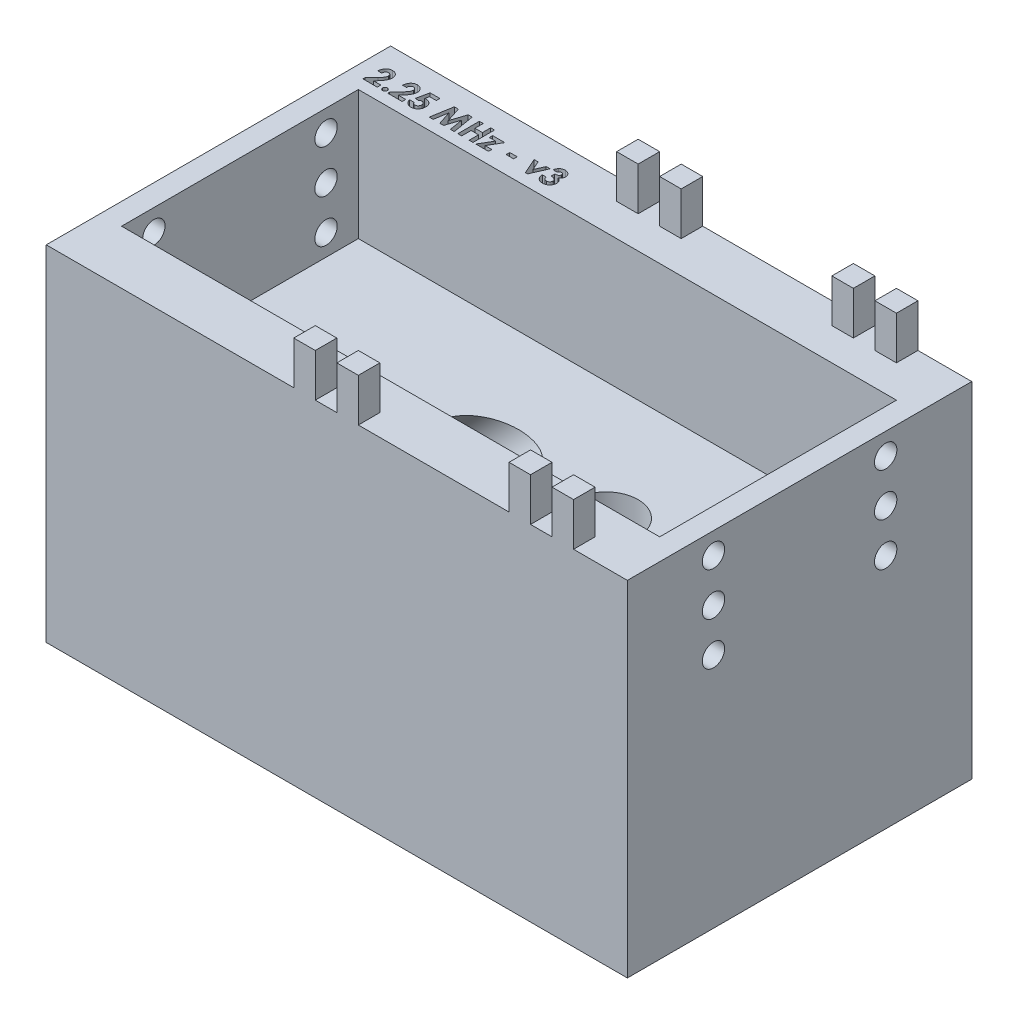
from build123d import *

# Parameters (mm, degrees)
SKETCH1_W                = 228.6
SKETCH1_H                = 127
BOSS_EXTRUDE1_DEPTH      = 50.8
SKETCH10_R               = 9.525
CUT_EXTRUDE6_DEPTH       = 196.514014843
SKETCH13_W               = 6.35
SKETCH13_H               = 6.35
BOSS_EXTRUDE3_DEPTH      = 12.7
SKETCH22_W               = 25.4
SKETCH22_H               = 101.6
CUT_EXTRUDE17_DEPTH      = 196.514014908
SKETCH23_W               = 254
SKETCH23_H               = 254
CUT_EXTRUDE18_DEPTH      = 25.4
SKETCH21_W               = 31.75
SKETCH21_H               = 101.6
CUT_EXTRUDE16_DEPTH      = 162.144934827
SKETCH26_W               = 158.75
SKETCH26_H               = 69.85
CUT_EXTRUDE21_DEPTH      = 38.1
CUT_EXTRUDE22_DEPTH      = 206.665511207
CUT_EXTRUDE22_DEPTH_BACK = 206.665511207
SKETCH27_R               = 3.302
SKETCH28_W               = 2.198076923
SKETCH28_H               = 1.058333333
CUT_EXTRUDE23_DEPTH      = 3.175


with BuildPart() as part:
    # Sketch1 → Boss-Extrude1 (new, symmetric)
    with BuildSketch(Plane.XY):
        with Locations((-25.4, -63.5)):
            Rectangle(SKETCH1_W, SKETCH1_H)
    extrude(amount=BOSS_EXTRUDE1_DEPTH, both=True)

    # Sketch10 → Cut-Extrude6 (cut, through all)
    with BuildSketch(Plane.XZ.offset(127)):
        Circle(SKETCH10_R)
    extrude(amount=-CUT_EXTRUDE6_DEPTH, mode=Mode.SUBTRACT)

    # Sketch2 → Cut-Revolve1 (revolve, cut)
    with BuildSketch(Plane.XY):
        Polygon((-66.480836064, -58.244528719), (-68.007479605, -56.717885178), (-13.829594426, -2.54), (0, 11.289594426), (55.278133078, 66.567727504), (59.72801651, 57.18801651), (0, -2.54), (-105.207008528, -107.747008528), (-129.286668415, -131.826668415), (-180.402882779, -182.942882779), (-185.791036451, -177.554729106), align=None)
    revolve(axis=Axis((-124.923032936, -127.463032936, 0), (0.7071067811865462, 0.7071067811865488, 0)), mode=Mode.SUBTRACT)

    # Sketch13 → Boss-Extrude3 (add)
    with BuildSketch(Plane(origin=(0, 0, 0), x_dir=(1, 0, 0), z_dir=(0, 1, 0))):
        with Locations((-38.1, 47.625)):
            Rectangle(SKETCH13_W, SKETCH13_H)
        with Locations((-25.4, 47.625)):
            Rectangle(SKETCH13_W, SKETCH13_H)
        with Locations((25.4, 47.625)):
            Rectangle(SKETCH13_W, SKETCH13_H)
        with Locations((38.1, 47.625)):
            Rectangle(SKETCH13_W, SKETCH13_H)
        with Locations((38.1, -47.625)):
            Rectangle(SKETCH13_W, SKETCH13_H)
        with Locations((25.4, -47.625)):
            Rectangle(SKETCH13_W, SKETCH13_H)
        with Locations((-25.4, -47.625)):
            Rectangle(SKETCH13_W, SKETCH13_H)
        with Locations((-38.1, -47.625)):
            Rectangle(SKETCH13_W, SKETCH13_H)
    extrude(amount=BOSS_EXTRUDE3_DEPTH)

    # Sketch22 → Cut-Extrude17 (cut, through all)
    with BuildSketch(Plane(origin=(0, 0, 0), x_dir=(1, 0, 0), z_dir=(0, 1, 0))):
        with Locations((-127, 0)):
            Rectangle(SKETCH22_W, SKETCH22_H)
    extrude(amount=-CUT_EXTRUDE17_DEPTH, mode=Mode.SUBTRACT)

    # Sketch23 → Cut-Extrude18 (cut)
    with BuildSketch(Plane.XZ.offset(127)):
        Rectangle(SKETCH23_W, SKETCH23_H)
    extrude(amount=-CUT_EXTRUDE18_DEPTH, mode=Mode.SUBTRACT)

    # Sketch21 → Cut-Extrude16 (cut, through all)
    with BuildSketch(Plane(origin=(0, 0, 0), x_dir=(1, 0, 0), z_dir=(0, 1, 0))):
        with Locations((73.025, 0)):
            Rectangle(SKETCH21_W, SKETCH21_H)
    extrude(amount=-CUT_EXTRUDE16_DEPTH, mode=Mode.SUBTRACT)

    # Sketch26 → Cut-Extrude21 (cut)
    with BuildSketch(Plane(origin=(0, 0, 0), x_dir=(1, 0, 0), z_dir=(0, 1, 0))):
        with Locations((-28.575, 0)):
            Rectangle(SKETCH26_W, SKETCH26_H)
    extrude(amount=-CUT_EXTRUDE21_DEPTH, mode=Mode.SUBTRACT)

    # Sketch27 → Cut-Extrude22 (cut, two sides: drawn at the far end of the back side and taken through both)
    with BuildSketch(Plane.ZY.offset(114.3).offset(-CUT_EXTRUDE22_DEPTH_BACK)):
        with Locations((-25.4, -6.35)):
            Circle(SKETCH27_R)
        with Locations((25.4, -6.35)):
            Circle(SKETCH27_R)
        with Locations((25.4, -19.05)):
            Circle(SKETCH27_R)
        with Locations((25.4, -31.75)):
            Circle(SKETCH27_R)
        with Locations((-25.4, -19.05)):
            Circle(SKETCH27_R)
        with Locations((-25.4, -31.75)):
            Circle(SKETCH27_R)
    extrude(amount=CUT_EXTRUDE22_DEPTH + CUT_EXTRUDE22_DEPTH_BACK, mode=Mode.SUBTRACT)

    # Sketch28 → Cut-Extrude23 (cut)
    with BuildSketch(Plane(origin=(0, 0, 0), x_dir=(1, 0, 0), z_dir=(0, 1, 0))):
        with BuildLine():
            Line((-108.679968791, 42.550408569), (-109.819712381, 42.550408569))
            add(Edge.make_bspline(
                [(-109.819712381, 42.550408569), (-109.814790003, 42.636624142), (-109.805171973, 42.805084195), (-109.766913878, 43.049777816), (-109.715649344, 43.28098638), (-109.647230018, 43.497901095), (-109.561256657, 43.70044314), (-109.459941579, 43.889302993), (-109.340696413, 44.063486302), (-109.206059088, 44.222153058), (-109.058315376, 44.364494468), (-108.900532582, 44.490703305), (-108.730297204, 44.59484766), (-108.550719582, 44.680548823), (-108.361830296, 44.74902007), (-108.161842154, 44.794798639), (-107.952486764, 44.825800335), (-107.809166047, 44.828513108), (-107.736118631, 44.829895748)],
                knots=[0, 0, 0, 0, 1.199038563, 2.342849363, 3.436047546, 4.486744587, 5.497670872, 6.488682221, 7.459191391, 8.424610317, 9.374430501, 10.305433194, 11.225809216, 12.140057399, 13.06607119, 14.010487599, 14.985989317, 16, 16, 16, 16], degree=3))
            add(Edge.make_bspline(
                [(-107.736118631, 44.829895748), (-107.646453965, 44.827097975), (-107.471407524, 44.821636064), (-107.217051161, 44.775044156), (-106.979510128, 44.697111989), (-106.758957095, 44.588220199), (-106.55726967, 44.449884594), (-106.374481297, 44.284942026), (-106.216119789, 44.089931913), (-106.081181086, 43.872968307), (-105.969063152, 43.643234383), (-105.890495573, 43.405679979), (-105.83885395, 43.166608826), (-105.833346051, 43.005630412), (-105.830609817, 42.92565897)],
                knots=[0, 0, 0, 0, 1.075374347, 2.099382735, 3.09057751, 4.06680945, 5.040638231, 6.016817125, 7.011024321, 8.044445721, 9.0776792, 10.070479129, 11.0414456, 12, 12, 12, 12], degree=3))
            add(Edge.make_bspline(
                [(-105.830609817, 42.92565897), (-105.831675162, 42.877286589), (-105.833819438, 42.779924936), (-105.848728877, 42.632592859), (-105.871095981, 42.482517913), (-105.904820123, 42.329828774), (-105.946876892, 42.17448264), (-105.997897832, 42.016014614), (-106.059066425, 41.855323151), (-106.129361889, 41.690599697), (-106.213224555, 41.521309458), (-106.310870974, 41.344914709), (-106.424892902, 41.161571926), (-106.553913097, 40.970245895), (-106.698558181, 40.771238367), (-106.859534262, 40.565148815), (-107.034987274, 40.351251044), (-107.159511212, 40.208272389), (-107.223488423, 40.134813617)],
                knots=[0, 0, 0, 0, 0.728284026, 1.46585585, 2.227944881, 3.01186502, 3.81876927, 4.650621989, 5.517437689, 6.406905708, 7.346299482, 8.360816762, 9.441613733, 10.596154504, 11.834900912, 13.145207542, 14.533280747, 16, 16, 16, 16], degree=3))
            Line((-107.223488423, 40.134813617), (-107.886218791, 39.375408569))
            Line((-107.886218791, 39.375408569), (-105.749199561, 39.375408569))
            Line((-105.749199561, 39.375408569), (-105.749199561, 38.317075236))
            Line((-105.749199561, 38.317075236), (-109.982532894, 38.317075236))
            Line((-109.982532894, 38.317075236), (-109.982532894, 38.894579242))
            Line((-109.982532894, 38.894579242), (-108.102464785, 40.8954907))
            add(Edge.make_bspline(
                [(-108.102464785, 40.8954907), (-108.048031982, 40.953857909), (-107.942611785, 41.066897883), (-107.792609708, 41.232909111), (-107.656871079, 41.390449803), (-107.538210549, 41.541197451), (-107.430400965, 41.680262414), (-107.338249549, 41.811836283), (-107.260913187, 41.934729584), (-107.176953598, 42.082917442), (-107.097219587, 42.259657832), (-107.024058806, 42.463270009), (-106.979462248, 42.657876356), (-106.973306513, 42.784686036), (-106.970353407, 42.845520748)],
                knots=[0, 0, 0, 0, 1.246127091, 2.413378631, 3.493388633, 4.492180848, 5.408488754, 6.240484944, 6.999099869, 7.674939598, 8.898438119, 10.020720584, 11.050475521, 12, 12, 12, 12], degree=3))
            add(Edge.make_bspline(
                [(-106.970353407, 42.845520748), (-106.972561373, 42.90437364), (-106.97683966, 43.018410552), (-107.023854577, 43.180627453), (-107.096691715, 43.327498297), (-107.19932953, 43.454634419), (-107.32365607, 43.5591106), (-107.467327066, 43.636817048), (-107.629171176, 43.681653313), (-107.74262698, 43.687265211), (-107.800992429, 43.690152159)],
                knots=[0, 0, 0, 0, 1.062038974, 2.057870785, 3.028805853, 4.01125022, 4.991535629, 5.949134679, 6.94496649, 8, 8, 8, 8], degree=3))
            add(Edge.make_bspline(
                [(-107.800992429, 43.690152159), (-107.831144764, 43.689085686), (-107.890504476, 43.686986162), (-107.977758614, 43.673010202), (-108.060787195, 43.648379032), (-108.140514374, 43.61537673), (-108.21608928, 43.571631942), (-108.28732129, 43.517709521), (-108.354960924, 43.454979759), (-108.418697958, 43.383638803), (-108.47670698, 43.304022276), (-108.528230382, 43.216857311), (-108.570831657, 43.122198014), (-108.608339368, 43.021294032), (-108.63726711, 42.913061575), (-108.658330094, 42.798148402), (-108.674342875, 42.676741461), (-108.678059371, 42.593285606), (-108.679968791, 42.550408569)],
                knots=[0, 0, 0, 0, 0.903469896, 1.778625579, 2.63899355, 3.493148037, 4.358286772, 5.247621495, 6.164656832, 7.118446693, 8.109501108, 9.111810964, 10.146451449, 11.215617525, 12.33435995, 13.498009769, 14.714554818, 16, 16, 16, 16], degree=3))
        make_face()
        with BuildLine():
            add(Edge.make_bspline(
                [(-104.080289304, 39.619639338), (-104.034279207, 39.617116715), (-103.943693271, 39.612150106), (-103.812808946, 39.575084821), (-103.694685089, 39.508491756), (-103.589066577, 39.421632645), (-103.499758223, 39.317129537), (-103.435208165, 39.19795652), (-103.395011225, 39.06757651), (-103.390573454, 38.97670558), (-103.388302125, 38.930196229)],
                knots=[0, 0, 0, 0, 1.016957001, 2.002212695, 2.9757545, 3.99499976, 5.013036768, 5.994806404, 6.97370641, 8, 8, 8, 8], degree=3))
            add(Edge.make_bspline(
                [(-103.388302125, 38.930196229), (-103.390558575, 38.883679409), (-103.394967274, 38.792793885), (-103.435486324, 38.66215982), (-103.499661765, 38.542007309), (-103.589073743, 38.436384382), (-103.694247686, 38.347888329), (-103.813080534, 38.28190935), (-103.943443939, 38.242741446), (-104.034235322, 38.238046495), (-104.080289304, 38.235664979)],
                knots=[0, 0, 0, 0, 1.023218912, 1.999186227, 2.986238111, 4.008388923, 5.030539734, 6.0011649, 6.986089706, 8, 8, 8, 8], degree=3))
            add(Edge.make_bspline(
                [(-104.080289304, 38.235664979), (-104.126354199, 38.23802713), (-104.217167094, 38.242683902), (-104.347733141, 38.282239497), (-104.467443305, 38.347447828), (-104.572643674, 38.436491727), (-104.662455104, 38.541633289), (-104.724805978, 38.662538922), (-104.765702452, 38.792744634), (-104.770050881, 38.883662735), (-104.772276484, 38.930196229)],
                knots=[0, 0, 0, 0, 1.013427518, 1.99788335, 2.976245624, 3.997909735, 5.019573847, 6.001765691, 6.977268297, 8, 8, 8, 8], degree=3))
            add(Edge.make_bspline(
                [(-104.772276484, 38.930196229), (-104.770036198, 38.976722544), (-104.765659081, 39.067626618), (-104.725083345, 39.197573051), (-104.662355176, 39.317505589), (-104.572651164, 39.421525076), (-104.467003649, 39.508928819), (-104.348006252, 39.574759198), (-104.216917888, 39.612208075), (-104.126310366, 39.617136241), (-104.080289304, 39.619639338)],
                knots=[0, 0, 0, 0, 1.025808215, 2.00424526, 2.981110158, 3.998665696, 5.017428914, 5.998734231, 6.983523959, 8, 8, 8, 8], degree=3))
        make_face()
        with BuildLine():
            Line((-101.353045714, 42.550408569), (-102.492789304, 42.550408569))
            add(Edge.make_bspline(
                [(-102.492789304, 42.550408569), (-102.487866926, 42.636624142), (-102.478248896, 42.805084195), (-102.439990801, 43.049777816), (-102.388726267, 43.28098638), (-102.320306941, 43.497901095), (-102.23433358, 43.70044314), (-102.133018502, 43.889302993), (-102.013773336, 44.063486302), (-101.879136012, 44.222153058), (-101.7313923, 44.364494468), (-101.573609505, 44.490703305), (-101.403374127, 44.59484766), (-101.223796505, 44.680548823), (-101.034907219, 44.74902007), (-100.834919077, 44.794798639), (-100.625563687, 44.825800335), (-100.48224297, 44.828513108), (-100.409195554, 44.829895748)],
                knots=[0, 0, 0, 0, 1.199038563, 2.342849363, 3.436047546, 4.486744587, 5.497670872, 6.488682221, 7.459191391, 8.424610317, 9.374430501, 10.305433194, 11.225809216, 12.140057399, 13.06607119, 14.010487599, 14.985989317, 16, 16, 16, 16], degree=3))
            add(Edge.make_bspline(
                [(-100.409195554, 44.829895748), (-100.319530888, 44.827097975), (-100.144484447, 44.821636064), (-99.890128084, 44.775044156), (-99.652587051, 44.697111989), (-99.432034018, 44.588220199), (-99.230346593, 44.449884594), (-99.04755822, 44.284942026), (-98.889196712, 44.089931913), (-98.754258009, 43.872968307), (-98.642140075, 43.643234383), (-98.563572496, 43.405679979), (-98.511930873, 43.166608826), (-98.506422974, 43.005630412), (-98.50368674, 42.92565897)],
                knots=[0, 0, 0, 0, 1.075374347, 2.099382735, 3.09057751, 4.06680945, 5.040638231, 6.016817125, 7.011024321, 8.044445721, 9.0776792, 10.070479129, 11.0414456, 12, 12, 12, 12], degree=3))
            add(Edge.make_bspline(
                [(-98.50368674, 42.92565897), (-98.504752085, 42.877286589), (-98.506896361, 42.779924936), (-98.5218058, 42.632592859), (-98.544172904, 42.482517913), (-98.577897046, 42.329828774), (-98.619953815, 42.17448264), (-98.670974756, 42.016014614), (-98.732143348, 41.855323151), (-98.802438812, 41.690599697), (-98.886301479, 41.521309458), (-98.983947897, 41.344914709), (-99.097969825, 41.161571926), (-99.22699002, 40.970245895), (-99.371635104, 40.771238367), (-99.532611185, 40.565148815), (-99.708064197, 40.351251044), (-99.832588135, 40.208272389), (-99.896565346, 40.134813617)],
                knots=[0, 0, 0, 0, 0.728284026, 1.46585585, 2.227944881, 3.01186502, 3.81876927, 4.650621989, 5.517437689, 6.406905708, 7.346299482, 8.360816762, 9.441613733, 10.596154504, 11.834900912, 13.145207542, 14.533280747, 16, 16, 16, 16], degree=3))
            Line((-99.896565346, 40.134813617), (-100.559295714, 39.375408569))
            Line((-100.559295714, 39.375408569), (-98.422276484, 39.375408569))
            Line((-98.422276484, 39.375408569), (-98.422276484, 38.317075236))
            Line((-98.422276484, 38.317075236), (-102.655609817, 38.317075236))
            Line((-102.655609817, 38.317075236), (-102.655609817, 38.894579242))
            Line((-102.655609817, 38.894579242), (-100.775541708, 40.8954907))
            add(Edge.make_bspline(
                [(-100.775541708, 40.8954907), (-100.721108905, 40.953857909), (-100.615688708, 41.066897883), (-100.465686631, 41.232909111), (-100.329948002, 41.390449803), (-100.211287472, 41.541197451), (-100.103477888, 41.680262414), (-100.011326472, 41.811836283), (-99.93399011, 41.934729584), (-99.850030521, 42.082917442), (-99.77029651, 42.259657832), (-99.69713573, 42.463270009), (-99.652539171, 42.657876356), (-99.646383436, 42.784686036), (-99.64343033, 42.845520748)],
                knots=[0, 0, 0, 0, 1.246127091, 2.413378631, 3.493388633, 4.492180848, 5.408488754, 6.240484944, 6.999099869, 7.674939598, 8.898438119, 10.020720584, 11.050475521, 12, 12, 12, 12], degree=3))
            add(Edge.make_bspline(
                [(-99.64343033, 42.845520748), (-99.645638296, 42.90437364), (-99.649916583, 43.018410552), (-99.6969315, 43.180627453), (-99.769768638, 43.327498297), (-99.872406453, 43.454634419), (-99.996732993, 43.5591106), (-100.140403989, 43.636817048), (-100.302248099, 43.681653313), (-100.415703903, 43.687265211), (-100.474069352, 43.690152159)],
                knots=[0, 0, 0, 0, 1.062038974, 2.057870785, 3.028805853, 4.01125022, 4.991535629, 5.949134679, 6.94496649, 8, 8, 8, 8], degree=3))
            add(Edge.make_bspline(
                [(-100.474069352, 43.690152159), (-100.504221687, 43.689085686), (-100.563581399, 43.686986162), (-100.650835537, 43.673010202), (-100.733864118, 43.648379032), (-100.813591297, 43.61537673), (-100.889166203, 43.571631942), (-100.960398213, 43.517709521), (-101.028037847, 43.454979759), (-101.091774881, 43.383638803), (-101.149783903, 43.304022276), (-101.201307305, 43.216857311), (-101.24390858, 43.122198014), (-101.281416291, 43.021294032), (-101.310344033, 42.913061575), (-101.331407018, 42.798148402), (-101.347419798, 42.676741461), (-101.351136294, 42.593285606), (-101.353045714, 42.550408569)],
                knots=[0, 0, 0, 0, 0.903469896, 1.778625579, 2.63899355, 3.493148037, 4.358286772, 5.247621495, 6.164656832, 7.118446693, 8.109501108, 9.111810964, 10.146451449, 11.215617525, 12.33435995, 13.498009769, 14.714554818, 16, 16, 16, 16], degree=3))
        make_face()
        with BuildLine():
            Line((-96.510407493, 44.667075236), (-93.619071355, 44.667075236))
            Line((-93.619071355, 44.667075236), (-93.619071355, 43.608741902))
            Line((-93.619071355, 43.608741902), (-95.607262461, 43.608741902))
            Line((-95.607262461, 43.608741902), (-95.855309336, 42.40794062))
            add(Edge.make_bspline(
                [(-95.855309336, 42.40794062), (-95.821509399, 42.41735433), (-95.754848978, 42.435920098), (-95.65442497, 42.454539215), (-95.557100113, 42.466607535), (-95.493236135, 42.468217288), (-95.462250442, 42.468998313)],
                knots=[0, 0, 0, 0, 1.05461699, 2.079921384, 3.068411212, 4, 4, 4, 4], degree=3))
            add(Edge.make_bspline(
                [(-95.462250442, 42.468998313), (-95.394729372, 42.467451106), (-95.261630468, 42.464401222), (-95.066923663, 42.435447873), (-94.880480394, 42.389847225), (-94.702871199, 42.324811292), (-94.534269578, 42.240165346), (-94.374471154, 42.13776748), (-94.2232798, 42.017437844), (-94.083381311, 41.879101104), (-93.954836736, 41.727204232), (-93.843074559, 41.562911691), (-93.747622686, 41.388566135), (-93.671703566, 41.203083835), (-93.611781724, 41.007629744), (-93.568480863, 40.802078611), (-93.542874901, 40.586186825), (-93.539422094, 40.438899295), (-93.537661099, 40.363779963)],
                knots=[0, 0, 0, 0, 1.01440847, 1.999622559, 2.951875003, 3.895578053, 4.836219714, 5.782137149, 6.743708247, 7.735272588, 8.734977101, 9.730283169, 10.717124674, 11.717316708, 12.737475749, 13.78628267, 14.87096371, 16, 16, 16, 16], degree=3))
            add(Edge.make_bspline(
                [(-93.537661099, 40.363779963), (-93.539813063, 40.287807853), (-93.544059516, 40.137892672), (-93.571763735, 39.917464328), (-93.620662179, 39.706343737), (-93.687829084, 39.503965733), (-93.776317182, 39.311817747), (-93.88273623, 39.12790927), (-94.008885488, 38.953605395), (-94.153526998, 38.790692948), (-94.310771294, 38.641787844), (-94.47819935, 38.510795739), (-94.654634935, 38.400566944), (-94.840082304, 38.311483441), (-95.033477488, 38.24100216), (-95.234879184, 38.189695152), (-95.445266178, 38.160273434), (-95.588091612, 38.156283006), (-95.660687942, 38.154254723)],
                knots=[0, 0, 0, 0, 1.06808661, 2.107647099, 3.116961351, 4.110378221, 5.100014249, 6.085620622, 7.093190682, 8.119403071, 9.144090782, 10.133780668, 11.103064255, 12.062861538, 13.020824475, 13.992378307, 14.979551724, 16, 16, 16, 16], degree=3))
            add(Edge.make_bspline(
                [(-95.660687942, 38.154254723), (-95.725608679, 38.155913985), (-95.853645959, 38.159186396), (-96.042239252, 38.179300361), (-96.224064128, 38.21486204), (-96.398155298, 38.266328997), (-96.566344491, 38.329673072), (-96.726687391, 38.408896809), (-96.880065112, 38.50249168), (-97.026042117, 38.608749578), (-97.162246489, 38.728444979), (-97.286559406, 38.859472218), (-97.399733477, 39.000179761), (-97.499346952, 39.152303511), (-97.585087573, 39.315618714), (-97.661124106, 39.488200664), (-97.723360769, 39.671851665), (-97.754944083, 39.799168742), (-97.770994432, 39.863870107)],
                knots=[0, 0, 0, 0, 1.054957082, 2.080596141, 3.077793124, 4.061112343, 5.027190972, 5.994718051, 6.962465889, 7.943658696, 8.924948258, 9.904494768, 10.875059, 11.855380583, 12.854004648, 13.869083016, 14.917087635, 16, 16, 16, 16], degree=3))
            Line((-97.770994432, 39.863870107), (-96.46843033, 39.863870107))
            add(Edge.make_bspline(
                [(-96.46843033, 39.863870107), (-96.444619427, 39.819034696), (-96.398345653, 39.731902191), (-96.310322707, 39.616220699), (-96.211786606, 39.517572491), (-96.103626201, 39.434993755), (-95.985140679, 39.373127172), (-95.861158102, 39.326210417), (-95.730120928, 39.299098962), (-95.640878827, 39.295709761), (-95.595814144, 39.293998313)],
                knots=[0, 0, 0, 0, 1.104910296, 2.147267069, 3.153527244, 4.136738762, 5.099945312, 6.05603338, 7.018353, 8, 8, 8, 8], degree=3))
            add(Edge.make_bspline(
                [(-95.595814144, 39.293998313), (-95.564404664, 39.295180083), (-95.502605983, 39.297505235), (-95.411555399, 39.309805876), (-95.324643617, 39.33310301), (-95.241224467, 39.365364125), (-95.161073865, 39.405597379), (-95.085340799, 39.456389242), (-95.012707647, 39.514852558), (-94.944280183, 39.581939412), (-94.882304624, 39.656725649), (-94.827958838, 39.737088559), (-94.77936621, 39.821242461), (-94.743372908, 39.912520901), (-94.713897437, 40.008198274), (-94.692190508, 40.108996304), (-94.67921817, 40.215032713), (-94.678017279, 40.287420797), (-94.677404689, 40.32434687)],
                knots=[0, 0, 0, 0, 0.978869489, 1.925942215, 2.855067702, 3.774946051, 4.70828698, 5.642468714, 6.60995405, 7.609372294, 8.622401667, 9.629904756, 10.629323, 11.642352373, 12.678539694, 13.745912462, 14.850161547, 16, 16, 16, 16], degree=3))
            add(Edge.make_bspline(
                [(-94.677404689, 40.32434687), (-94.67811567, 40.360415806), (-94.679499613, 40.430624865), (-94.690947862, 40.533716912), (-94.71142856, 40.631532608), (-94.739333687, 40.724821147), (-94.77505558, 40.813016037), (-94.818710122, 40.896642256), (-94.870483809, 40.975277103), (-94.930654602, 41.047319652), (-94.994820117, 41.113399126), (-95.063754498, 41.171191707), (-95.136836684, 41.219155537), (-95.211795735, 41.261029356), (-95.291623746, 41.291504209), (-95.374525707, 41.312491116), (-95.460414435, 41.327890464), (-95.518997273, 41.328795232), (-95.548748839, 41.329254723)],
                knots=[0, 0, 0, 0, 1.166249705, 2.270133367, 3.348514167, 4.393962215, 5.415026464, 6.420877785, 7.440098956, 8.453121383, 9.451844239, 10.415694839, 11.355045125, 12.27538808, 13.187007209, 14.108269027, 15.039275622, 16, 16, 16, 16], degree=3))
            add(Edge.make_bspline(
                [(-95.548748839, 41.329254723), (-95.581065956, 41.328028468), (-95.645836389, 41.32557079), (-95.742069043, 41.305573319), (-95.837141398, 41.27320991), (-95.931582155, 41.228559459), (-96.024453826, 41.170126106), (-96.118207339, 41.101590484), (-96.209704564, 41.017972827), (-96.267881044, 40.955694206), (-96.297977605, 40.923475476)],
                knots=[0, 0, 0, 0, 0.88288272, 1.769486374, 2.674910571, 3.623812639, 4.617874466, 5.670434592, 6.794841017, 8, 8, 8, 8], degree=3))
            Line((-96.297977605, 40.923475476), (-97.257092189, 41.143537575))
            Line((-97.257092189, 41.143537575), (-96.510407493, 44.667075236))
        make_face()
        Polygon((-89.371745634, 44.667075236), (-88.188752846, 44.667075236), (-86.739904689, 40.237848473), (-85.28088025, 44.667075236), (-84.109335779, 44.667075236), (-83.035738022, 38.317075236), (-84.189474, 38.317075236), (-84.867468791, 42.327802399), (-86.187841388, 38.317075236), (-87.299600202, 38.317075236), (-88.612340586, 42.327802399), (-89.289063343, 38.317075236), (-90.444071355, 38.317075236), align=None)
        Polygon((-81.977404689, 44.667075236), (-80.837661099, 44.667075236), (-80.837661099, 42.224767543), (-78.639584176, 42.224767543), (-78.639584176, 44.667075236), (-77.499840586, 44.667075236), (-77.499840586, 38.317075236), (-78.639584176, 38.317075236), (-78.639584176, 41.085023954), (-80.837661099, 41.085023954), (-80.837661099, 38.317075236), (-81.977404689, 38.317075236), align=None)
        Polygon((-76.360096996, 42.957459851), (-72.778045714, 42.957459851), (-74.912520875, 39.293998313), (-72.940866227, 39.293998313), (-72.940866227, 38.317075236), (-76.685738022, 38.317075236), (-74.551262862, 41.980536774), (-76.360096996, 41.980536774), align=None)
        with Locations((-68.422596997, 40.637267544)):
            Rectangle(SKETCH28_W, SKETCH28_H)
        Polygon((-64.107853407, 42.957459851), (-62.947757253, 42.957459851), (-61.746955971, 40.218767944), (-60.546154689, 42.957459851), (-59.386058535, 42.957459851), (-61.418770875, 38.317075236), (-62.075141067, 38.317075236), align=None)
        with BuildLine():
            Line((-57.554327766, 43.120280364), (-58.694071355, 43.120280364))
            add(Edge.make_bspline(
                [(-58.694071355, 43.120280364), (-58.686024332, 43.17725208), (-58.670248676, 43.288941355), (-58.632499641, 43.450639603), (-58.587347722, 43.604021457), (-58.530977858, 43.748601189), (-58.464865178, 43.884636342), (-58.389681974, 44.012593723), (-58.304615487, 44.131924116), (-58.239411124, 44.203809218), (-58.206881852, 44.239671389)],
                knots=[0, 0, 0, 0, 1.111473889, 2.178970933, 3.205615836, 4.199322666, 5.174200091, 6.12565194, 7.064921805, 8, 8, 8, 8], degree=3))
            add(Edge.make_bspline(
                [(-58.206881852, 44.239671389), (-58.159962688, 44.286988926), (-58.067489945, 44.380246818), (-57.912957147, 44.499699876), (-57.750978236, 44.603078375), (-57.578304653, 44.685037596), (-57.397623331, 44.751374091), (-57.207497428, 44.795932464), (-57.008703869, 44.825497338), (-56.873052273, 44.828409581), (-56.803826964, 44.829895748)],
                knots=[0, 0, 0, 0, 1.01925491, 2.00884431, 2.983262333, 3.955970413, 4.92937149, 5.924503185, 6.940838805, 8, 8, 8, 8], degree=3))
            add(Edge.make_bspline(
                [(-56.803826964, 44.829895748), (-56.742282104, 44.828442795), (-56.621297309, 44.825586581), (-56.443480103, 44.802658446), (-56.273946278, 44.762445049), (-56.110903812, 44.709866936), (-55.956750528, 44.638325625), (-55.808084114, 44.555281391), (-55.669058315, 44.453424186), (-55.539347837, 44.338335796), (-55.420184024, 44.213856435), (-55.31698764, 44.080798235), (-55.228267857, 43.942715488), (-55.15517449, 43.798460987), (-55.098975624, 43.647790635), (-55.059971945, 43.491574836), (-55.034443089, 43.33015829), (-55.031899748, 43.220445639), (-55.030609817, 43.164801598)],
                knots=[0, 0, 0, 0, 1.091422571, 2.145516843, 3.172569842, 4.178562979, 5.178154469, 6.181868002, 7.194278174, 8.227918432, 9.254613415, 10.245994977, 11.209837596, 12.161663635, 13.10878368, 14.055455738, 15.013766427, 16, 16, 16, 16], degree=3))
            add(Edge.make_bspline(
                [(-55.030609817, 43.164801598), (-55.033256833, 43.095891087), (-55.038467993, 42.960227477), (-55.081229339, 42.761673704), (-55.148162472, 42.571820864), (-55.244853893, 42.393325283), (-55.365742796, 42.226672727), (-55.514069432, 42.07743489), (-55.685609072, 41.943271925), (-55.814386165, 41.871172731), (-55.880329368, 41.83425272)],
                knots=[0, 0, 0, 0, 0.992805628, 1.954529043, 2.915727527, 3.886831945, 4.871318353, 5.87440735, 6.911542536, 8, 8, 8, 8], degree=3))
            add(Edge.make_bspline(
                [(-55.880329368, 41.83425272), (-55.835066965, 41.81939212), (-55.746128373, 41.790191707), (-55.619712859, 41.732681826), (-55.49950615, 41.669833058), (-55.387578162, 41.596819356), (-55.282815637, 41.516593073), (-55.18585722, 41.428468403), (-55.096123606, 41.332637501), (-55.01507966, 41.228573332), (-54.943149991, 41.117940201), (-54.87861133, 41.003293666), (-54.825492414, 40.882895093), (-54.780494079, 40.758119515), (-54.746234909, 40.627845515), (-54.722113391, 40.492577893), (-54.708170562, 40.352625203), (-54.706044043, 40.257807341), (-54.704968791, 40.209863697)],
                knots=[0, 0, 0, 0, 1.059543567, 2.081955587, 3.086750234, 4.076226789, 5.052108497, 6.020845489, 6.989030705, 7.970690546, 8.952259656, 9.923888338, 10.895517021, 11.877585046, 12.873342345, 13.889638361, 14.932918083, 16, 16, 16, 16], degree=3))
            add(Edge.make_bspline(
                [(-54.704968791, 40.209863697), (-54.707148471, 40.139406007), (-54.711446356, 40.000477791), (-54.738770297, 39.795850747), (-54.789642551, 39.60075704), (-54.856567819, 39.412951823), (-54.945838864, 39.234859594), (-55.050895875, 39.062393379), (-55.180032051, 38.901534257), (-55.323544736, 38.748029532), (-55.48292394, 38.60846991), (-55.655716925, 38.487477997), (-55.838124122, 38.383645409), (-56.03129957, 38.299351155), (-56.235176155, 38.234434939), (-56.449299453, 38.187510506), (-56.674569154, 38.158801361), (-56.828333349, 38.155791752), (-56.90686182, 38.154254723)],
                knots=[0, 0, 0, 0, 1.005138573, 1.981928558, 2.936866704, 3.876260664, 4.820238198, 5.773547, 6.751179199, 7.756627054, 8.768222608, 9.766606018, 10.760583154, 11.757261445, 12.767156078, 13.807575856, 14.880313354, 16, 16, 16, 16], degree=3))
            add(Edge.make_bspline(
                [(-56.90686182, 38.154254723), (-56.981148487, 38.15587526), (-57.126406235, 38.159044006), (-57.338876092, 38.18647111), (-57.540808579, 38.230713254), (-57.732719031, 38.293076224), (-57.913864964, 38.373950339), (-58.085889077, 38.470253264), (-58.245358667, 38.587539527), (-58.394050541, 38.720514605), (-58.528666264, 38.869705093), (-58.648981018, 39.031655066), (-58.752341843, 39.206980355), (-58.839172624, 39.394931895), (-58.908794538, 39.595839412), (-58.9637121, 39.809294349), (-59.002072916, 40.035713731), (-59.013755783, 40.191495082), (-59.019712381, 40.270921389)],
                knots=[0, 0, 0, 0, 1.066544725, 2.085487077, 3.070979577, 4.031932826, 4.977951092, 5.916076795, 6.857635327, 7.814973522, 8.776389752, 9.738577119, 10.707772778, 11.69409279, 12.707140348, 13.757286496, 14.856535458, 16, 16, 16, 16], degree=3))
            Line((-59.019712381, 40.270921389), (-57.879968791, 40.270921389))
            add(Edge.make_bspline(
                [(-57.879968791, 40.270921389), (-57.872746355, 40.2309848), (-57.858678766, 40.153197817), (-57.831240797, 40.04057956), (-57.795485296, 39.936625952), (-57.75414304, 39.840413057), (-57.709487179, 39.750677635), (-57.655532221, 39.670733834), (-57.596231702, 39.598410854), (-57.510660619, 39.512432498), (-57.388330863, 39.424093327), (-57.223145164, 39.347322384), (-57.039391718, 39.30232518), (-56.910929733, 39.296835659), (-56.844532093, 39.293998313)],
                knots=[0, 0, 0, 0, 0.928156231, 1.807827665, 2.648129825, 3.438902246, 4.202261636, 4.936546065, 5.639352463, 6.338805438, 7.70633318, 9.064371875, 10.482673459, 12, 12, 12, 12], degree=3))
            add(Edge.make_bspline(
                [(-56.844532093, 39.293998313), (-56.809299158, 39.294602499), (-56.740285721, 39.295785965), (-56.638915259, 39.308903099), (-56.54234562, 39.330507028), (-56.450396939, 39.359865967), (-56.362483865, 39.396669233), (-56.280286066, 39.444124842), (-56.202128144, 39.499298762), (-56.128859747, 39.561328895), (-56.061158239, 39.628919536), (-56.004826603, 39.703764686), (-55.953343563, 39.779820737), (-55.915266336, 39.862063542), (-55.881902482, 39.94606756), (-55.861482099, 40.034881873), (-55.846063243, 40.126643397), (-55.845167161, 40.189440956), (-55.844712381, 40.221312014)],
                knots=[0, 0, 0, 0, 1.110435564, 2.175094844, 3.216326037, 4.226890168, 5.215276772, 6.21526065, 7.213097102, 8.228249917, 9.239874822, 10.221364777, 11.178138315, 12.128914389, 13.072518965, 14.022636769, 14.996447288, 16, 16, 16, 16], degree=3))
            add(Edge.make_bspline(
                [(-55.844712381, 40.221312014), (-55.845919737, 40.256168447), (-55.848323307, 40.325559619), (-55.867960721, 40.426821442), (-55.898972348, 40.524227155), (-55.942051287, 40.617345399), (-55.999578408, 40.705832959), (-56.067459769, 40.791465163), (-56.151043299, 40.869785008), (-56.242745625, 40.947201801), (-56.349084298, 41.014685895), (-56.464880476, 41.076963799), (-56.593177461, 41.126517784), (-56.730843409, 41.17077867), (-56.880482402, 41.203106135), (-57.041165235, 41.226579025), (-57.212632705, 41.244050953), (-57.33082746, 41.246557589), (-57.391507253, 41.247844466)],
                knots=[0, 0, 0, 0, 0.809814727, 1.612155564, 2.388397, 3.182215007, 3.988903953, 4.837162975, 5.715530372, 6.646997145, 7.623086902, 8.637258368, 9.698941581, 10.815059213, 11.996518529, 13.252603015, 14.589518788, 16, 16, 16, 16], degree=3))
            Line((-57.391507253, 41.247844466), (-57.391507253, 42.3061778))
            add(Edge.make_bspline(
                [(-57.391507253, 42.3061778), (-57.315957301, 42.312611875), (-57.174618304, 42.324648757), (-56.978432196, 42.352797422), (-56.813268783, 42.390422748), (-56.67515836, 42.435815667), (-56.560480313, 42.494112001), (-56.460298205, 42.558468579), (-56.374016634, 42.633209339), (-56.301097133, 42.716105522), (-56.242763801, 42.80512825), (-56.201478866, 42.898893844), (-56.174216453, 42.994501083), (-56.171633341, 43.059893552), (-56.170353407, 43.092295588)],
                knots=[0, 0, 0, 0, 1.70044513, 3.18119609, 4.440695891, 5.496282586, 6.431922213, 7.318171381, 8.16090191, 8.983045123, 9.787564368, 10.536848927, 11.275007137, 12, 12, 12, 12], degree=3))
            add(Edge.make_bspline(
                [(-56.170353407, 43.092295588), (-56.17256166, 43.133637068), (-56.176871703, 43.214326884), (-56.210345832, 43.329811009), (-56.268453127, 43.432755534), (-56.346364806, 43.522943836), (-56.441302896, 43.598275865), (-56.55258698, 43.652965634), (-56.677802188, 43.685098315), (-56.765897833, 43.688429391), (-56.811459176, 43.690152159)],
                knots=[0, 0, 0, 0, 1.009664648, 1.970651636, 2.907870547, 3.878035693, 4.867062054, 5.849714035, 6.887914197, 8, 8, 8, 8], degree=3))
            add(Edge.make_bspline(
                [(-56.811459176, 43.690152159), (-56.852755411, 43.688119474), (-56.934699789, 43.684086006), (-57.054526997, 43.653981265), (-57.168322922, 43.603303681), (-57.273731173, 43.53342228), (-57.369230159, 43.449497679), (-57.447607273, 43.350106409), (-57.512797641, 43.241203174), (-57.540430121, 43.160745984), (-57.554327766, 43.120280364)],
                knots=[0, 0, 0, 0, 0.98818071, 1.960853194, 2.938124878, 3.957524365, 4.978590984, 5.968022688, 6.978025184, 8, 8, 8, 8], degree=3))
        make_face()
    extrude(amount=-CUT_EXTRUDE23_DEPTH, mode=Mode.SUBTRACT)


solid = part.part
